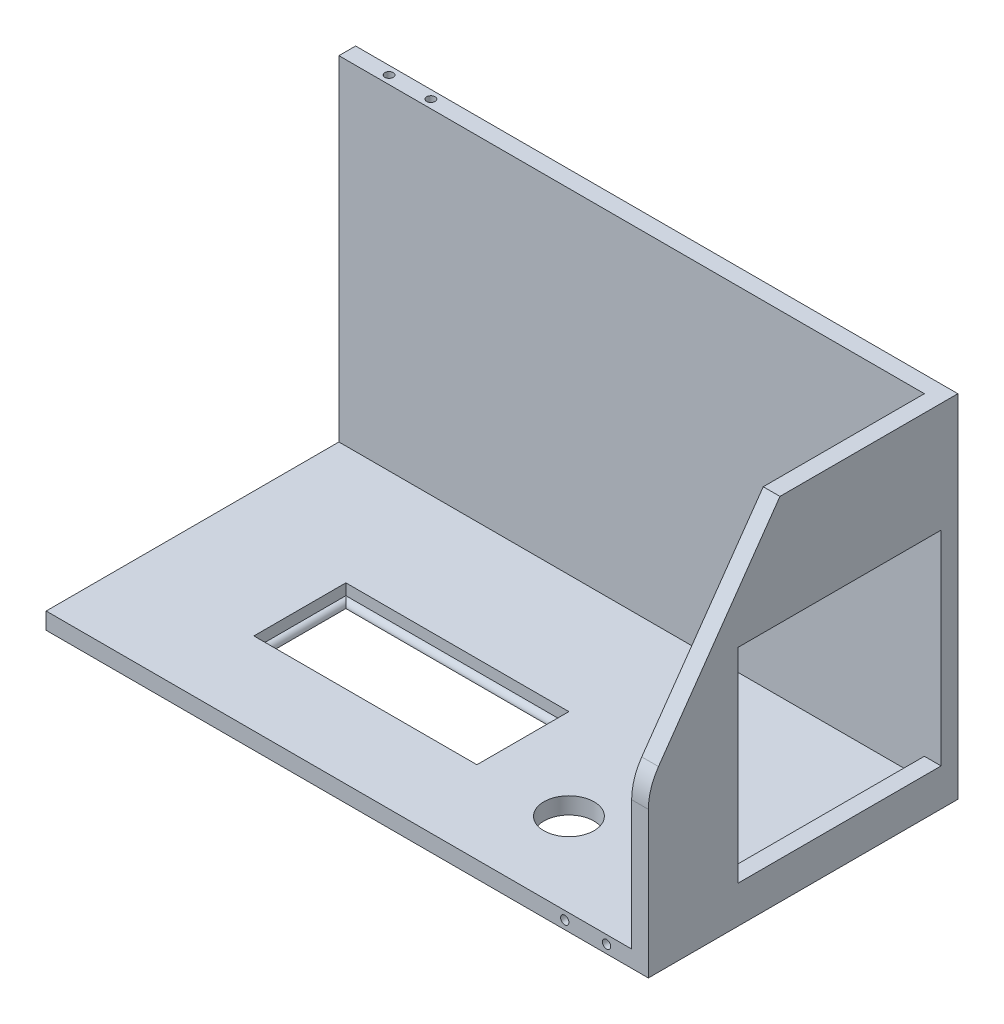
from build123d import *

# Parameters (mm, degrees)
SKETCH1_W           = 210
SKETCH1_H           = 105
BOSS_EXTRUDE1_DEPTH = 6
SKETCH2_W           = 210
SKETCH2_H           = 6
BOSS_EXTRUDE2_DEPTH = 126
SKETCH3_W           = 111
SKETCH3_H           = 126
BOSS_EXTRUDE3_DEPTH = 6
CUT_EXTRUDE2_DEPTH  = 6
SKETCH7_R           = 9
CUT_EXTRUDE3_DEPTH  = 24
SKETCH8_W           = 72.8
SKETCH8_H           = 73.25
CUT_EXTRUDE4_DEPTH  = 24
SKETCH9_W           = 80
SKETCH9_H           = 33
CUT_EXTRUDE5_DEPTH  = 24
FILLET1_R           = 20
SKETCH11_W          = 80
SKETCH11_H          = 33
SKETCH11_W_2        = 76
SKETCH11_H_2        = 29
BOSS_EXTRUDE4_DEPTH = 2
FILLET2_R           = 2
SKETCH12_R          = 1.5
CUT_EXTRUDE6_DEPTH  = 20
SKETCH13_R          = 1.5
CUT_EXTRUDE7_DEPTH  = 25


with BuildPart() as part:
    # Sketch1 → Boss-Extrude1 (new body)
    with BuildSketch(Plane(origin=(0, 0, 0), x_dir=(1, 0, 0), z_dir=(0, 1, 0))):
        with Locations((105, 52.5)):
            Rectangle(SKETCH1_W, SKETCH1_H)
    extrude(amount=BOSS_EXTRUDE1_DEPTH)

    # Sketch2 → Boss-Extrude2 (add)
    with BuildSketch(Plane.XZ):
        with Locations((105, -108)):
            Rectangle(SKETCH2_W, SKETCH2_H)
    extrude(amount=-BOSS_EXTRUDE2_DEPTH)

    # Sketch3 → Boss-Extrude3 (add)
    with BuildSketch(Plane(origin=(210, 0, 0), x_dir=(0, 0, -1), z_dir=(1, 0, 0))):
        with Locations((55.5, 63)):
            Rectangle(SKETCH3_W, SKETCH3_H)
    extrude(amount=BOSS_EXTRUDE3_DEPTH)

    # Sketch6 → Cut-Extrude2 (cut)
    with BuildSketch(Plane(origin=(216, 0, 0), x_dir=(0, 0, -1), z_dir=(1, 0, 0))):
        Polygon((0, 58.7), (47.2, 126), (0, 126), align=None)
    extrude(amount=-CUT_EXTRUDE2_DEPTH, mode=Mode.SUBTRACT)

    # Sketch7 → Cut-Extrude3 (cut)
    with BuildSketch(Plane(origin=(0, 6, 0), x_dir=(1, 0, 0), z_dir=(0, 1, 0))):
        with Locations(Location((157.5, 30, 0), (0, 0, 270))):
            Circle(SKETCH7_R)
    extrude(amount=-CUT_EXTRUDE3_DEPTH, mode=Mode.SUBTRACT)

    # Sketch8 → Cut-Extrude4 (cut)
    with BuildSketch(Plane(origin=(216, 0, 0), x_dir=(0, 0, -1), z_dir=(1, 0, 0))):
        with Locations((68.6, 50)):
            Rectangle(SKETCH8_W, SKETCH8_H)
    extrude(amount=-CUT_EXTRUDE4_DEPTH, mode=Mode.SUBTRACT)

    # Sketch9 → Cut-Extrude5 (cut)
    with BuildSketch(Plane(origin=(0, 6, 0), x_dir=(1, 0, 0), z_dir=(0, 1, 0))):
        with Locations((85, 46)):
            Rectangle(SKETCH9_W, SKETCH9_H)
    extrude(amount=-CUT_EXTRUDE5_DEPTH, mode=Mode.SUBTRACT)

    # Fillet1
    fillet1_edges = [part.edges().sort_by_distance(p)[0] for p in [
        (213, 58.7, 0),
    ]]
    fillet(fillet1_edges, radius=FILLET1_R)

    # Sketch11 → Boss-Extrude4 (add)
    with BuildSketch(Plane.XZ):
        with Locations((85, -46)):
            Rectangle(SKETCH11_W, SKETCH11_H)
        with Locations((85, -46)):
            Rectangle(SKETCH11_W_2, SKETCH11_H_2, mode=Mode.SUBTRACT)
    extrude(amount=-BOSS_EXTRUDE4_DEPTH)

    # Fillet2
    fillet2_edges = [part.edges().sort_by_distance(p)[0] for p in [
        (85, 2, -31.5),
        (123, 2, -46),
        (85, 2, -60.5),
        (47, 2, -46),
    ]]
    fillet(fillet2_edges, radius=FILLET2_R - 0.0001)  # a hair under: the kernel refuses the full size

    # Sketch12 → Cut-Extrude6 (cut)
    with BuildSketch(Plane.XY):
        with Locations((201, 3)):
            Circle(SKETCH12_R)
        with Locations((186, 3)):
            Circle(SKETCH12_R)
    extrude(amount=-CUT_EXTRUDE6_DEPTH, mode=Mode.SUBTRACT)

    # Sketch13 → Cut-Extrude7 (cut)
    with BuildSketch(Plane(origin=(0, 126, 0), x_dir=(1, 0, 0), z_dir=(0, 1, 0))):
        with Locations(Location((15, 108, 0), (0, 0, 270))):
            Circle(SKETCH13_R)
        with Locations(Location((30, 108, 0), (0, 0, 270))):
            Circle(SKETCH13_R)
    extrude(amount=-CUT_EXTRUDE7_DEPTH, mode=Mode.SUBTRACT)


solid = part.part
